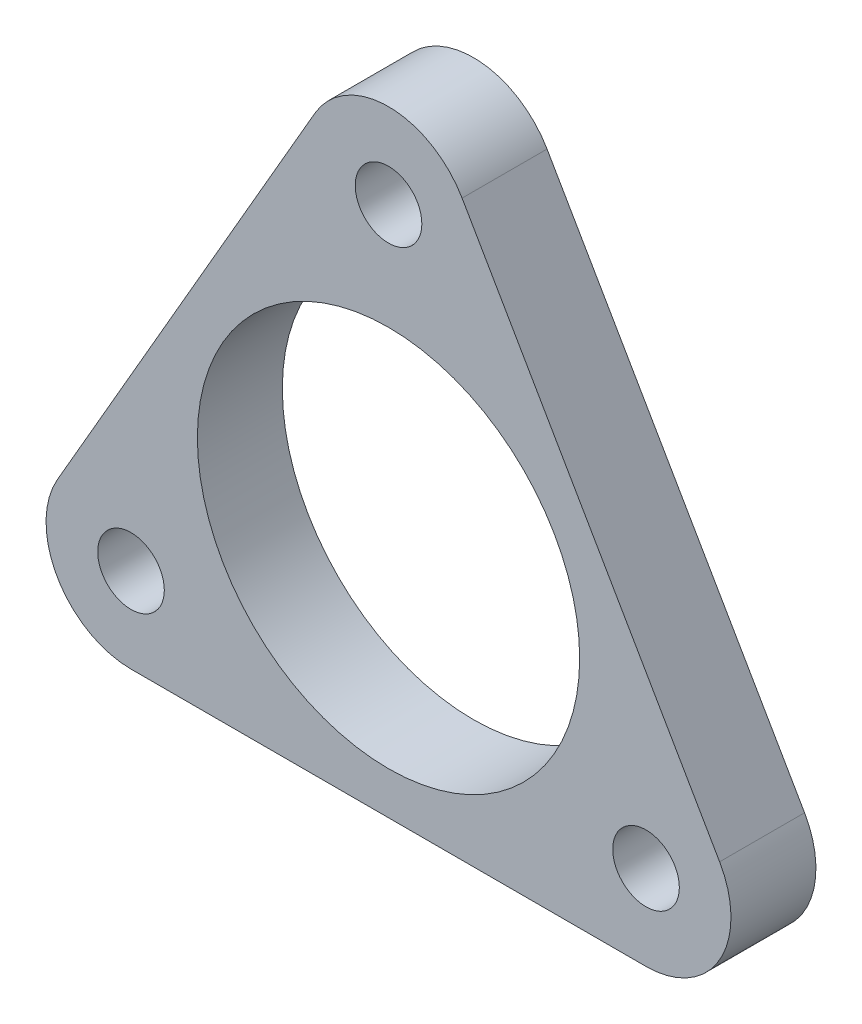
from build123d import *

# Parameters (mm, degrees)
SKETCH2_R           = 14.2875
SKETCH2_R_2         = 2.4892
BOSS_EXTRUDE1_DEPTH = 6.35
FILLET1_R           = 6.35


with BuildPart() as part:
    # Sketch2 → Boss-Extrude1 (new body)
    with BuildSketch(Plane.XY):
        Polygon((0, 34.925), (30.245937227, -17.4625), (-30.245937227, -17.4625), align=None)
        Circle(SKETCH2_R, mode=Mode.SUBTRACT)
        with Locations((0, 22.225)):
            Circle(SKETCH2_R_2, mode=Mode.SUBTRACT)
        with Locations((19.247414599, -11.1125)):
            Circle(SKETCH2_R_2, mode=Mode.SUBTRACT)
        with Locations((-19.247414599, -11.1125)):
            Circle(SKETCH2_R_2, mode=Mode.SUBTRACT)
    extrude(amount=BOSS_EXTRUDE1_DEPTH)

    # Fillet1
    fillet1_edges = [part.edges().sort_by_distance(p)[0] for p in [
        (30.245937227, -17.4625, 3.175),
        (-30.245937227, -17.4625, 3.175),
        (0, 34.925, 3.175),
    ]]
    fillet(fillet1_edges, radius=FILLET1_R)


solid = part.part
